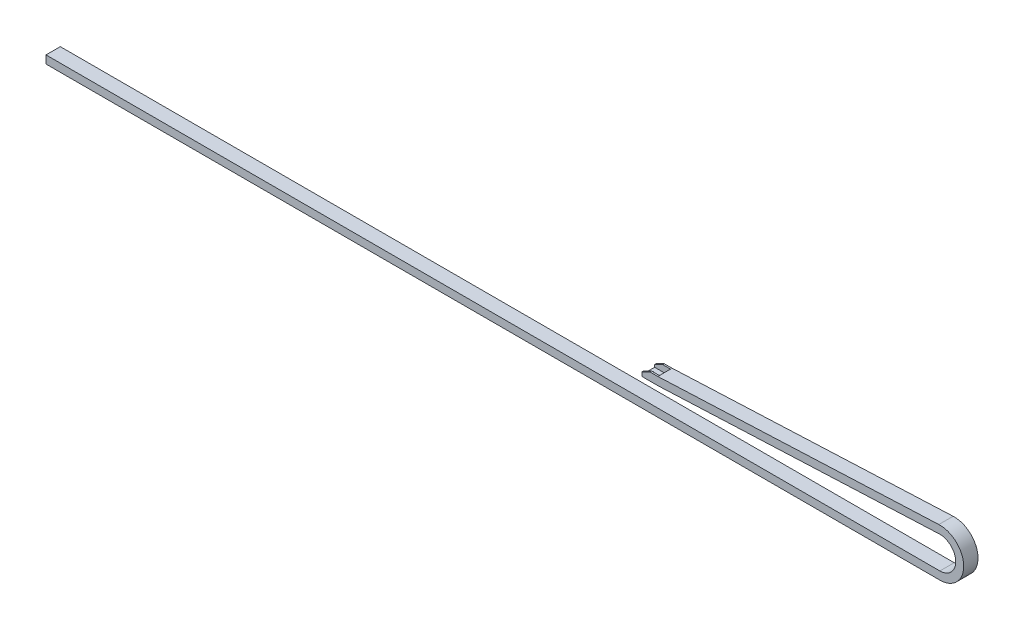
from build123d import *

# Parameters (mm, degrees)
BOSS_EXTRUDE1_DEPTH = 18
SHELL1_START        = 2
SHELL1_DEPTH        = 14
CUT_EXTRUDE1_REACH  = 1157.717
SKETCH2_R           = 1.5


# Read off the part's stored shape, not the designer's step: Shell1
with BuildPart() as part:
    # Sketch1 → Boss-Extrude1 (new body)
    with BuildSketch(Plane.XY):
        with BuildLine():
            Line((0, 0), (1125, 0))
            ThreePointArc((1125, 0), (1154.992825207, 30.656076303), (1123.688161208, 59.971304259))
            Line((1123.688161208, 59.971304259), (770, 44.490434753))
            Line((770, 44.490434753), (760, 44.490434753))
            Line((760, 44.490434753), (750, 39.5))
            Line((750, 39.5), (750, 34.5))
            Line((750, 34.5), (770.437279597, 34.5))
            Line((770.437279597, 34.5), (1124.125440805, 49.980869506))
            ThreePointArc((1124.125440805, 49.980869506), (1144.995216805, 30.437384202), (1125, 10))
            Line((1125, 10), (0, 10))
            Line((0, 10), (0, 0))
        make_face()
    extrude(amount=BOSS_EXTRUDE1_DEPTH)

    # Shell1 outline → Shell1 (cut)
    with BuildSketch(Plane.XY.offset(SHELL1_START)):
        with BuildLine():
            Line((815.73732715, 44.490434753), (760, 44.490434753))
            Line((760, 44.490434753), (750, 39.5))
            Line((750, 39.5), (750, 36.5))
            Line((750, 36.5), (770.393530714, 36.5))
            Line((770.393530714, 36.5), (1124.037984886, 51.978956457))
            ThreePointArc((1124.037984886, 51.978956457), (1146.994738485, 30.481122622), (1125, 8))
            Line((1125, 8), (0, 8))
            Line((0, 8), (0, 2))
            Line((0, 2), (1125, 2))
            ThreePointArc((1125, 2), (1152.993303526, 30.612337883), (1123.775617127, 57.973217308))
            Line((1123.775617127, 57.973217308), (815.73732715, 44.490434753))
        make_face()
    extrude(amount=SHELL1_DEPTH, mode=Mode.SUBTRACT)

    # Sketch2 → Cut-Extrude1 (cut, up to next)
    with BuildSketch(Plane(origin=(0, 36.5, 0), x_dir=(1, 0, 0), z_dir=(0, 1, 0)), mode=Mode.PRIVATE) as cut_extrude1_sk1:
        with Locations(Location((754, -9, 0), (0, 0, 180))):
            Circle(SKETCH2_R)
    cut_extrude1_tool1 = extrude(cut_extrude1_sk1.sketch, amount=-CUT_EXTRUDE1_REACH, mode=Mode.PRIVATE) & part.part
    # Sketch2 → Cut-Extrude1 (cut, up to next)
    with BuildSketch(Plane(origin=(0, 36.5, 0), x_dir=(1, 0, 0), z_dir=(0, 1, 0)), mode=Mode.PRIVATE) as cut_extrude1_sk2:
        with Locations(Location((762, -9, 0), (0, 0, 180))):
            Circle(SKETCH2_R)
    cut_extrude1_tool2 = extrude(cut_extrude1_sk2.sketch, amount=-CUT_EXTRUDE1_REACH, mode=Mode.PRIVATE) & part.part
    add(cut_extrude1_tool1.solids().sort_by_distance((754, 36.5, 9))[0], mode=Mode.SUBTRACT)
    add(cut_extrude1_tool2.solids().sort_by_distance((762, 36.5, 9))[0], mode=Mode.SUBTRACT)


solid = part.part
